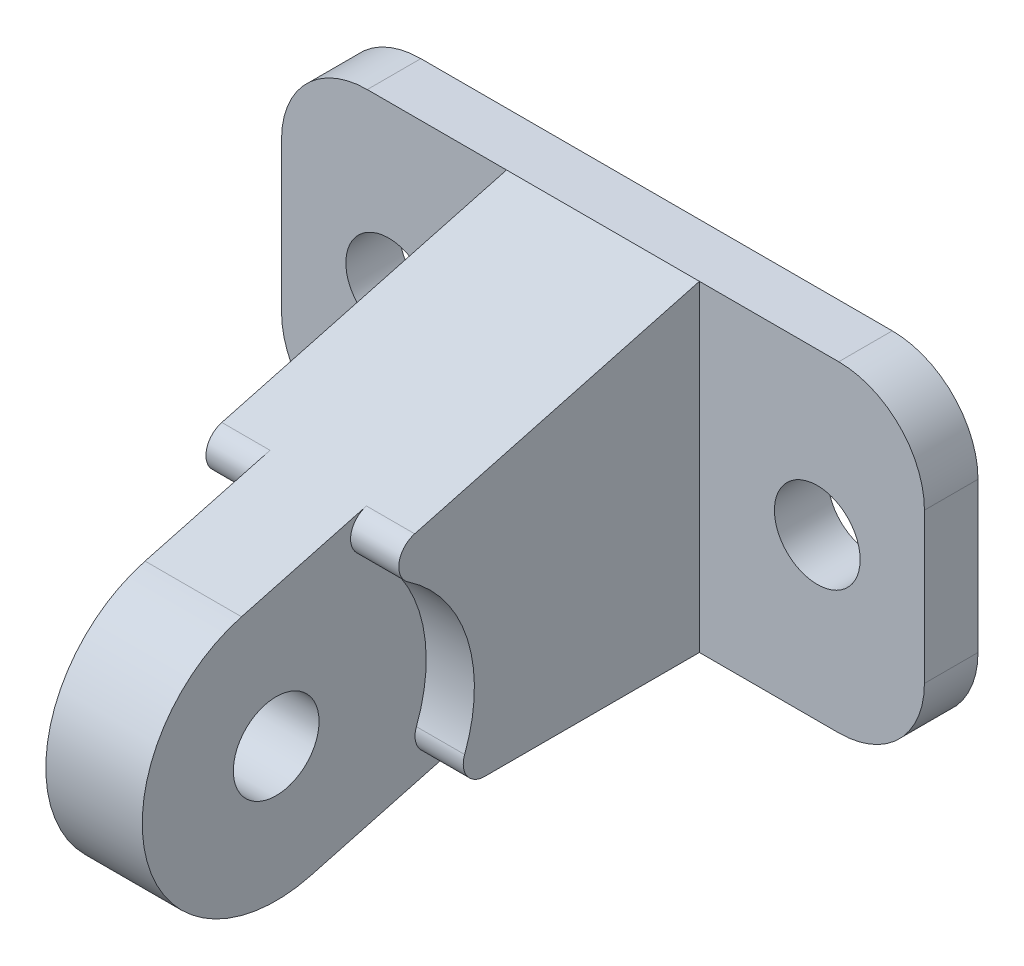
from build123d import *

# Parameters (mm, degrees)
SKETCH1_W           = 60
SKETCH1_H           = 30
BOSS_EXTRUDE1_DEPTH = 5
BOSS_EXTRUDE2_DEPTH = 9
SKETCH3_3_R         = 4
BOSS_EXTRUDE3_DEPTH = 4.5
HOLE1_D             = 8
FILLET1_R           = 8


with BuildPart() as part:
    # Sketch1 → Boss-Extrude1 (new body)
    with BuildSketch(Plane.XY):
        Rectangle(SKETCH1_W, SKETCH1_H)
    extrude(amount=BOSS_EXTRUDE1_DEPTH)

    # Sketch3 → Boss-Extrude2 (add, symmetric)
    with BuildSketch(Plane(origin=(0, 0, 0), x_dir=(0, 0, -1), z_dir=(1, 0, 0))):
        with BuildLine():
            Line((-5, 15), (-31.573908753, 7.87954261))
            ThreePointArc((-31.573908753, 7.87954261), (-33.028883618, 6.27753657), (-32.17423683, 4.289332839))
            ThreePointArc((-32.17423683, 4.289332839), (-26.655991742, -3.083912061), (-26.91214627, -12.289896749))
            ThreePointArc((-26.91214627, -12.289896749), (-26.688692003, -14.135736214), (-25.04245288, -15))
            Line((-25.04245288, -15), (-5, -15))
            Line((-5, -15), (-5, 15))
        make_face()
    extrude(amount=BOSS_EXTRUDE2_DEPTH, both=True)

    # Sketch3<3> → Boss-Extrude3 (add, symmetric)
    with BuildSketch(Plane(origin=(0, 0, 0), x_dir=(0, 0, -1), z_dir=(1, 0, 0))):
        with BuildLine():
            ThreePointArc((-32.17423683, 4.289332839), (-33.028883618, 6.27753657), (-31.573908753, 7.87954261))
            Line((-31.573908753, 7.87954261), (-43.235238064, 4.754898838))
            ThreePointArc((-43.235238064, 4.754898838), (-52.074072829, -10.554412054), (-36.764761936, -19.393246819))
            Line((-36.764761936, -19.393246819), (-20.368941598, -15))
            Line((-20.368941598, -15), (-25.04245288, -15))
            ThreePointArc((-25.04245288, -15), (-26.688692003, -14.135736214), (-26.91214627, -12.289896749))
            ThreePointArc((-26.91214627, -12.289896749), (-26.655991742, -3.083912061), (-32.17423683, 4.289332839))
        make_face()
        with Locations((-40, -7.31917399)):
            Circle(SKETCH3_3_R, mode=Mode.SUBTRACT)
    extrude(amount=BOSS_EXTRUDE3_DEPTH, both=True)

    # Hole1 (through all)
    with Locations(Plane.XY.offset(5)):
        with Locations((-20, 0), (20, 0)):
            Hole(HOLE1_D / 2)

    # Fillet1
    fillet1_edges = [part.edges().sort_by_distance(p)[0] for p in [
        (30, 15, 2.5),
        (30, -15, 2.5),
        (-30, 15, 2.5),
        (-30, -15, 2.5),
    ]]
    fillet(fillet1_edges, radius=FILLET1_R)


solid = part.part
